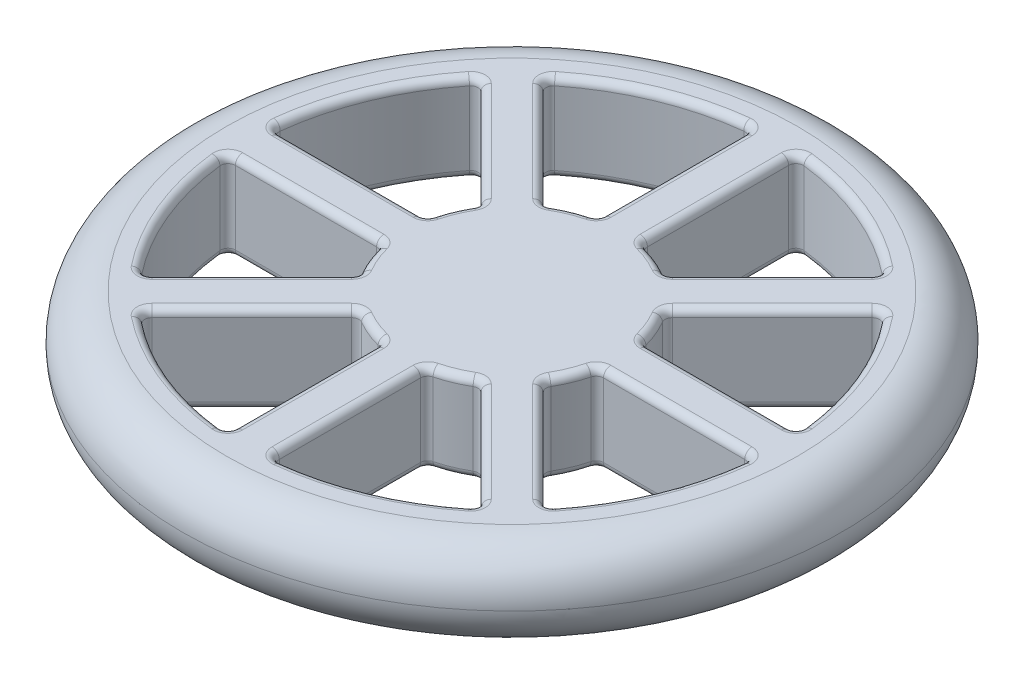
from build123d import *

# Parameters (mm, degrees)
BOSS_EXTRUDE1_DEPTH      = 3
BOSS_EXTRUDE1_DEPTH_BACK = 3
SKETCH1_R                = 22.5
FILLET1_R                = 3
CUT_EXTRUDE1_REACH       = 34.381
FILLET2_R                = 0.5
CIRPATTERN1_COUNT        = 8
FILLET2_OF_CIRPATTERN1_R = 0.5


with BuildPart() as part:
    # Sketch1 → Boss-Extrude1 (new, two sides: drawn at the far end of the back side and taken through both)
    with BuildSketch(Plane(origin=(0, 0, 0), x_dir=(1, 0, 0), z_dir=(0, 1, 0)).offset(-BOSS_EXTRUDE1_DEPTH_BACK)):
        with Locations(Location((0, 0, 0), (0, 0, 270))):
            Circle(SKETCH1_R)
    extrude(amount=BOSS_EXTRUDE1_DEPTH + BOSS_EXTRUDE1_DEPTH_BACK)

    # Fillet1
    fillet1_edges = [part.edges().sort_by_distance(p)[0] for p in [
        (0, 3, -22.5),
        (0, -3, -22.5),
    ]]
    fillet(fillet1_edges, radius=FILLET1_R - 0.0001)  # a hair under: the kernel refuses the full size

    # Sketch2 → Cut-Extrude1 (cut, up to next)
    with BuildSketch(Plane.XZ.offset(3), mode=Mode.PRIVATE) as cut_extrude1_sk1:
        with BuildLine():
            Line((1.5, 17.937391115), (1.5, 7.348469228))
            ThreePointArc((1.5, 7.348469228), (2.870125743, 6.929096494), (4.135492251, 6.256812594))
            Line((4.135492251, 6.256812594), (11.622990722, 13.744311066))
            ThreePointArc((11.622990722, 13.744311066), (6.888301783, 16.629831585), (1.5, 17.937391115))
        make_face()
    cut_extrude1_tool1 = extrude(cut_extrude1_sk1.sketch, amount=-CUT_EXTRUDE1_REACH, mode=Mode.PRIVATE) & part.part
    cut_extrude1 = cut_extrude1_tool1.solids().sort_by_distance((5.203134, -3, 12.561477))[0]
    add(cut_extrude1, mode=Mode.SUBTRACT)

    # Fillet2
    fillet2_edges = [part.edges().sort_by_distance(p)[0] for p in [
        (6.888301783, 3, 16.629831585),
        (1.5, 0, 17.937391115),
        (7.879241487, 3, 10.00056183),
        (11.622990722, 0, 13.744311066),
        (2.870125743, 3, 6.929096494),
        (4.135492251, 0, 6.256812594),
        (1.5, 3, 12.642930172),
        (1.5, 0, 7.348469228),
        (6.888301783, -3, 16.629831585),
        (1.5, -3, 12.642930172),
        (2.870125743, -3, 6.929096494),
        (7.879241487, -3, 10.00056183),
    ]]
    fillet(fillet2_edges, radius=FILLET2_R)

    # CirPattern1: Cut-Extrude1 ×8 about axis
    cirpattern1_axis = Axis((0, 0, 0), (0, 1, 0))
    for i in range(1, CIRPATTERN1_COUNT):
        add(cut_extrude1.rotate(cirpattern1_axis, i * 360 / CIRPATTERN1_COUNT), mode=Mode.SUBTRACT)

    # Fillet2 of CirPattern1
    fillet2_of_cirpattern1_edges = [part.edges().sort_by_distance(p)[0] for p in [
        (16.629831585, 3, 6.888301783),
        (13.744311066, 0, 11.622990722),
        (12.642930172, 3, 1.5),
        (17.937391115, 0, 1.5),
        (6.929096494, 3, 2.870125743),
        (7.348469228, 0, 1.5),
        (10.00056183, 3, 7.879241487),
        (6.256812594, 0, 4.135492251),
        (16.629831585, -3, 6.888301783),
        (10.00056183, -3, 7.879241487),
        (6.929096494, -3, 2.870125743),
        (12.642930172, -3, 1.5),
        (16.629831585, 3, -6.888301783),
        (17.937391115, 0, -1.5),
        (10.00056183, 3, -7.879241487),
        (13.744311066, 0, -11.622990722),
        (6.929096494, 3, -2.870125743),
        (6.256812594, 0, -4.135492251),
        (12.642930172, 3, -1.5),
        (7.348469228, 0, -1.5),
        (16.629831585, -3, -6.888301783),
        (12.642930172, -3, -1.5),
        (6.929096494, -3, -2.870125743),
        (10.00056183, -3, -7.879241487),
        (6.888301783, 3, -16.629831585),
        (11.622990722, 0, -13.744311066),
        (1.5, 3, -12.642930172),
        (1.5, 0, -17.937391115),
        (2.870125743, 3, -6.929096494),
        (1.5, 0, -7.348469228),
        (7.879241487, 3, -10.00056183),
        (4.135492251, 0, -6.256812594),
        (6.888301783, -3, -16.629831585),
        (7.879241487, -3, -10.00056183),
        (2.870125743, -3, -6.929096494),
        (1.5, -3, -12.642930172),
        (-6.888301783, 3, -16.629831585),
        (-1.5, 0, -17.937391115),
        (-7.879241487, 3, -10.00056183),
        (-11.622990722, 0, -13.744311066),
        (-2.870125743, 3, -6.929096494),
        (-4.135492251, 0, -6.256812594),
        (-1.5, 3, -12.642930172),
        (-1.5, 0, -7.348469228),
        (-6.888301783, -3, -16.629831585),
        (-1.5, -3, -12.642930172),
        (-2.870125743, -3, -6.929096494),
        (-7.879241487, -3, -10.00056183),
        (-16.629831585, 3, -6.888301783),
        (-13.744311066, 0, -11.622990722),
        (-12.642930172, 3, -1.5),
        (-17.937391115, 0, -1.5),
        (-6.929096494, 3, -2.870125743),
        (-7.348469228, 0, -1.5),
        (-10.00056183, 3, -7.879241487),
        (-6.256812594, 0, -4.135492251),
        (-16.629831585, -3, -6.888301783),
        (-10.00056183, -3, -7.879241487),
        (-6.929096494, -3, -2.870125743),
        (-12.642930172, -3, -1.5),
        (-16.629831585, 3, 6.888301783),
        (-17.937391115, 0, 1.5),
        (-10.00056183, 3, 7.879241487),
        (-13.744311066, 0, 11.622990722),
        (-6.929096494, 3, 2.870125743),
        (-6.256812594, 0, 4.135492251),
        (-12.642930172, 3, 1.5),
        (-7.348469228, 0, 1.5),
        (-16.629831585, -3, 6.888301783),
        (-12.642930172, -3, 1.5),
        (-6.929096494, -3, 2.870125743),
        (-10.00056183, -3, 7.879241487),
        (-6.888301783, 3, 16.629831585),
        (-11.622990722, 0, 13.744311066),
        (-1.5, 3, 12.642930172),
        (-1.5, 0, 17.937391115),
        (-2.870125743, 3, 6.929096494),
        (-1.5, 0, 7.348469228),
        (-7.879241487, 3, 10.00056183),
        (-4.135492251, 0, 6.256812594),
        (-6.888301783, -3, 16.629831585),
        (-7.879241487, -3, 10.00056183),
        (-2.870125743, -3, 6.929096494),
        (-1.5, -3, 12.642930172),
    ]]
    fillet(fillet2_of_cirpattern1_edges, radius=FILLET2_OF_CIRPATTERN1_R)


solid = part.part
